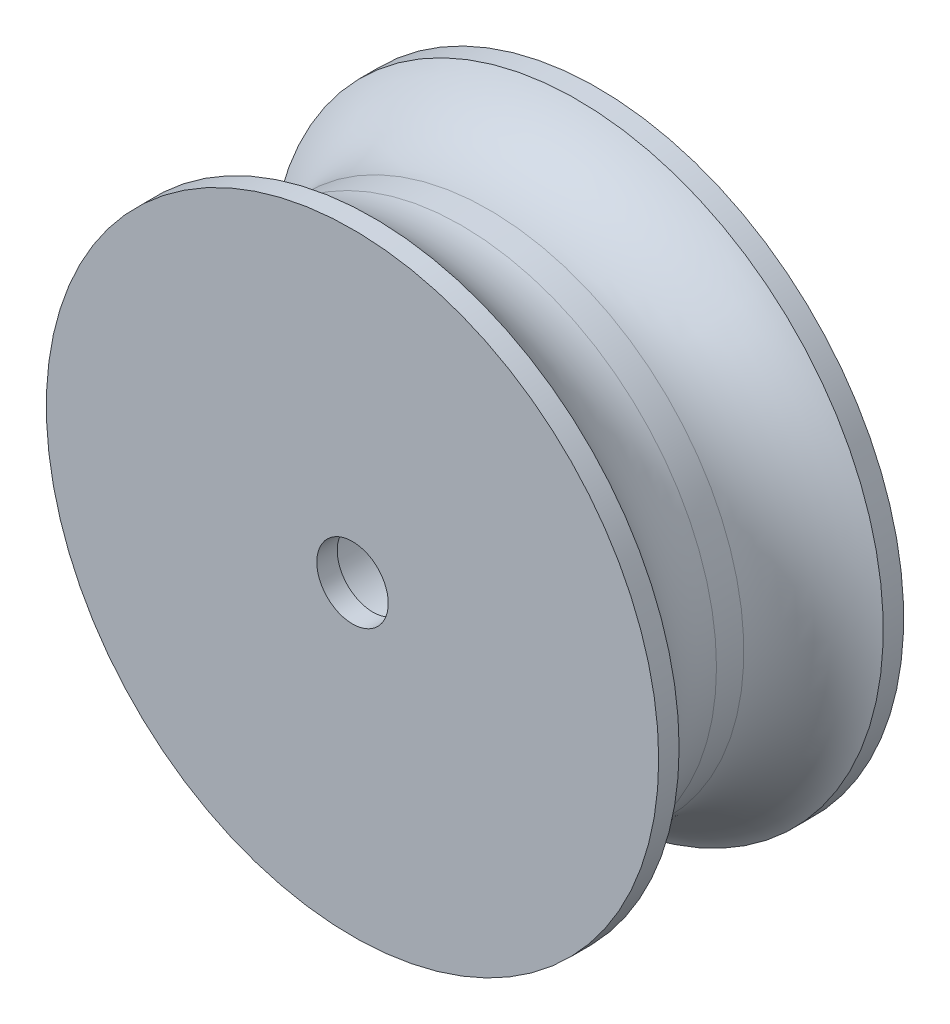
from build123d import *

# Parameters (mm, degrees)
SKETCH1_R                  = 12.5
BOSS_EXTRUDE1_DEPTH        = 10
F_6_0_204_DIAMETER_SLOT2_D = 5.1816
SKETCH10_R                 = 15
BOSS_EXTRUDE2_DEPTH        = 1
BOSS_EXTRUDE3_START        = 1
SKETCH12_R                 = 15
BOSS_EXTRUDE3_DEPTH        = 1
SKETCH13_R                 = 1.75
CUT_EXTRUDE1_DEPTH         = 25.372115214
FILLET4_R                  = 5
FILLET5_R                  = 5


with BuildPart() as part:
    # Sketch1 → Boss-Extrude1 (new body)
    with BuildSketch(Plane.XY):
        Circle(SKETCH1_R)
    extrude(amount=BOSS_EXTRUDE1_DEPTH)

    # #6 (0.204) Diameter Slot2 (through all)
    with Locations(Plane.XY.offset(10)):
        with Locations((0, 0)):
            Hole(F_6_0_204_DIAMETER_SLOT2_D / 2)

    # Sketch10 → Boss-Extrude2 (add)
    with BuildSketch(Plane(origin=(0, 0, 0), x_dir=(-1, 0, 0), z_dir=(0, 0, -1))):
        Circle(SKETCH10_R)
    extrude(amount=BOSS_EXTRUDE2_DEPTH)

    # Sketch12 → Boss-Extrude3 (add)
    with BuildSketch(Plane.XY.offset(10).offset(BOSS_EXTRUDE3_START)):
        with Locations(Location((0, 0, 0), (0, 0, 180))):
            Circle(SKETCH12_R)
    extrude(amount=-BOSS_EXTRUDE3_DEPTH)

    # Sketch13 → Cut-Extrude1 (cut, through all)
    with BuildSketch(Plane.XY.offset(11)):
        Circle(SKETCH13_R)
    extrude(amount=-CUT_EXTRUDE1_DEPTH, mode=Mode.SUBTRACT)

    # Fillet4
    # the kernel refuses this fillet: 5 mm, written as the material it adds along each edge
    with BuildSketch(Plane(origin=(0, 0, 10), x_dir=(1, 0, 0), z_dir=(0, -1, 0))) as fillet4_piece_1:
        with BuildLine():
            CenterArc((17.5, -4.330127019), FILLET4_R, 120, 60)
            Line((12.5, -4.330127019), (12.4, -4.330127019))
            Line((12.4, -4.330127019), (12.4, 0))
            Line((12.4, 0), (12.5, 0.1))
            ThreePointArc((12.5, 0.1), (13.75, 0.1), (14.95, 0.08660254))
            Line((14.95, 0.08660254), (15, 0))
        make_face()
    revolve(axis=Axis((0, 0, 10), (0, 0, 1)))

    # Fillet5
    # the kernel refuses this fillet: 5 mm, written as the material it adds along each edge
    with BuildSketch(Plane(origin=(0, 0, 0), x_dir=(1, 0, 0), z_dir=(0, -1, 0))) as fillet5_piece_1:
        with BuildLine():
            CenterArc((17.5, 4.330127019), FILLET5_R, 180, 60)
            Line((15, 0), (14.95, -0.08660254))
            ThreePointArc((14.95, -0.08660254), (13.75, -0.1), (12.5, -0.1))
            Line((12.5, -0.1), (12.4, 0))
            Line((12.4, 0), (12.4, 4.330127019))
            Line((12.4, 4.330127019), (12.5, 4.330127019))
        make_face()
    revolve(axis=Axis((0, 0, 0), (0, 0, 1)))


solid = part.part
